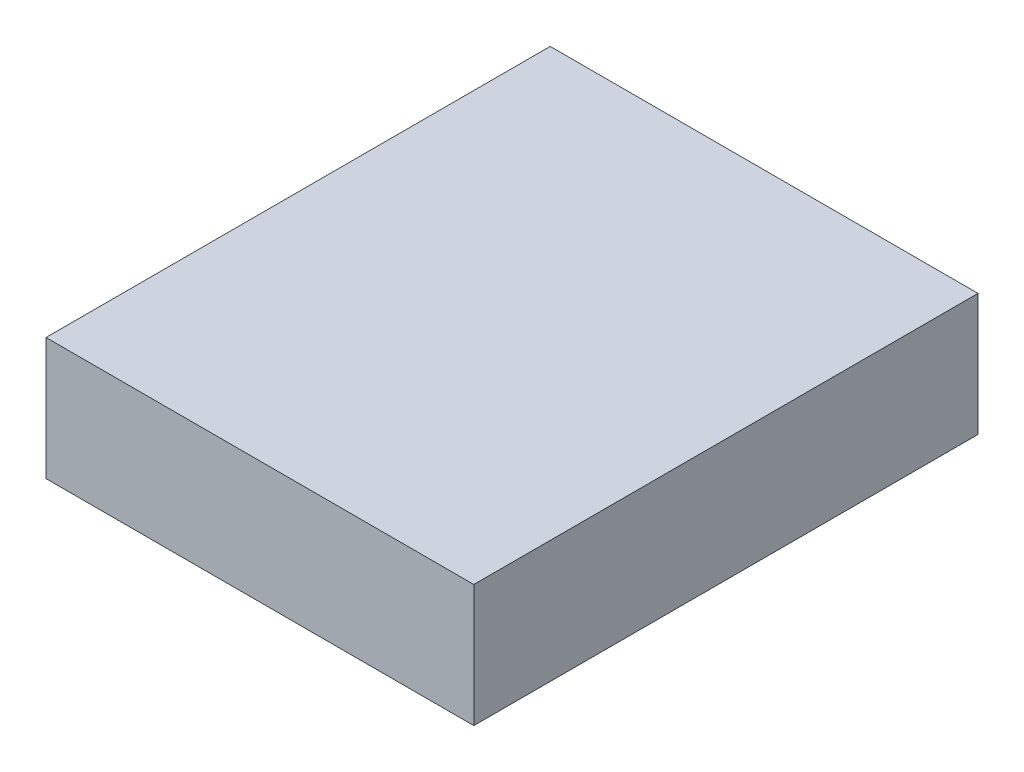
from build123d import *

# Parameters (mm, degrees)
SKETCH1_W           = 70
SKETCH1_H           = 82.5
BOSS_EXTRUDE1_DEPTH = 20


with BuildPart() as part:
    # Sketch1 → Boss-Extrude1 (new body)
    with BuildSketch(Plane(origin=(0, 0, 0), x_dir=(1, 0, 0), z_dir=(0, 1, 0))):
        Rectangle(SKETCH1_W, SKETCH1_H)
    extrude(amount=BOSS_EXTRUDE1_DEPTH)


solid = part.part
